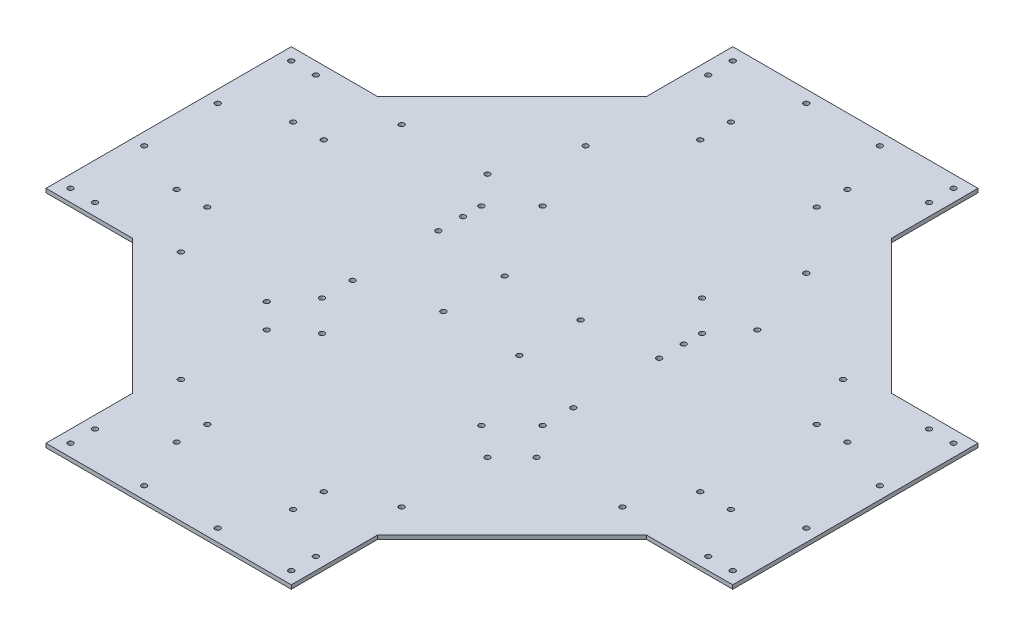
from build123d import *

# Parameters (mm, degrees)
SKETCH1_R           = 2.125
BOSS_EXTRUDE1_DEPTH = 3.175
SKETCH2_R           = 2.125
CUT_EXTRUDE1_DEPTH  = 396.992525971


with BuildPart() as part:
    # Sketch1 → Boss-Extrude1 (new body)
    with BuildSketch(Plane(origin=(0, 0, 0), x_dir=(1, 0, 0), z_dir=(0, 1, 0))):
        Polygon((-100, -280), (0, -280), (100, -280), (100, -209.601551084), (209.601551084, -100), (280, -100), (280, 0), (280, 100), (209.601551084, 100), (100, 209.601551084), (100, 280), (0, 280), (-100, 280), (-100, 209.601551084), (-209.601551084, 100), (-280, 100), (-280, 0), (-280, -100), (-209.601551084, -100), (-100, -209.601551084), align=None)
        with Locations((-90, -270)):
            Circle(SKETCH1_R, mode=Mode.SUBTRACT)
        with Locations((-90, -250)):
            Circle(SKETCH1_R, mode=Mode.SUBTRACT)
        with Locations((-30, -270)):
            Circle(SKETCH1_R, mode=Mode.SUBTRACT)
        with Locations((-47.5, -226)):
            Circle(SKETCH1_R, mode=Mode.SUBTRACT)
        with Locations((-90, -180)):
            Circle(SKETCH1_R, mode=Mode.SUBTRACT)
        with Locations((-47.5, -201)):
            Circle(SKETCH1_R, mode=Mode.SUBTRACT)
        with Locations((-270, -90)):
            Circle(SKETCH1_R, mode=Mode.SUBTRACT)
        with Locations((-250, -90)):
            Circle(SKETCH1_R, mode=Mode.SUBTRACT)
        with Locations((-180, -90)):
            Circle(SKETCH1_R, mode=Mode.SUBTRACT)
        with Locations((-226, -47.5)):
            Circle(SKETCH1_R, mode=Mode.SUBTRACT)
        with Locations((-270, -30)):
            Circle(SKETCH1_R, mode=Mode.SUBTRACT)
        with Locations((-201, -47.5)):
            Circle(SKETCH1_R, mode=Mode.SUBTRACT)
        with Locations((-90, -110)):
            Circle(SKETCH1_R, mode=Mode.SUBTRACT)
        with Locations((-110, -90)):
            Circle(SKETCH1_R, mode=Mode.SUBTRACT)
        with Locations((-90, -40)):
            Circle(SKETCH1_R, mode=Mode.SUBTRACT)
        with Locations((30, -270)):
            Circle(SKETCH1_R, mode=Mode.SUBTRACT)
        with Locations((47.5, -226)):
            Circle(SKETCH1_R, mode=Mode.SUBTRACT)
        with Locations((90, -270)):
            Circle(SKETCH1_R, mode=Mode.SUBTRACT)
        with Locations((90, -250)):
            Circle(SKETCH1_R, mode=Mode.SUBTRACT)
        with Locations((47.5, -201)):
            Circle(SKETCH1_R, mode=Mode.SUBTRACT)
        with Locations((90, -180)):
            Circle(SKETCH1_R, mode=Mode.SUBTRACT)
        with Locations((90, -110)):
            Circle(SKETCH1_R, mode=Mode.SUBTRACT)
        with Locations((110, -90)):
            Circle(SKETCH1_R, mode=Mode.SUBTRACT)
        with Locations((90, -40)):
            Circle(SKETCH1_R, mode=Mode.SUBTRACT)
        with Locations((180, -90)):
            Circle(SKETCH1_R, mode=Mode.SUBTRACT)
        with Locations((250, -90)):
            Circle(SKETCH1_R, mode=Mode.SUBTRACT)
        with Locations((270, -90)):
            Circle(SKETCH1_R, mode=Mode.SUBTRACT)
        with Locations((201, -47.5)):
            Circle(SKETCH1_R, mode=Mode.SUBTRACT)
        with Locations((226, -47.5)):
            Circle(SKETCH1_R, mode=Mode.SUBTRACT)
        with Locations((270, -30)):
            Circle(SKETCH1_R, mode=Mode.SUBTRACT)
        with Locations((-270, 30)):
            Circle(SKETCH1_R, mode=Mode.SUBTRACT)
        with Locations((-226, 47.5)):
            Circle(SKETCH1_R, mode=Mode.SUBTRACT)
        with Locations((-201, 47.5)):
            Circle(SKETCH1_R, mode=Mode.SUBTRACT)
        with Locations((-270, 90)):
            Circle(SKETCH1_R, mode=Mode.SUBTRACT)
        with Locations((-250, 90)):
            Circle(SKETCH1_R, mode=Mode.SUBTRACT)
        with Locations((-180, 90)):
            Circle(SKETCH1_R, mode=Mode.SUBTRACT)
        with Locations((-90, 30)):
            Circle(SKETCH1_R, mode=Mode.SUBTRACT)
        with Locations((-90, 50)):
            Circle(SKETCH1_R, mode=Mode.SUBTRACT)
        with Locations((-110, 90)):
            Circle(SKETCH1_R, mode=Mode.SUBTRACT)
        with Locations((-90, 150)):
            Circle(SKETCH1_R, mode=Mode.SUBTRACT)
        with Locations((-47.5, 201)):
            Circle(SKETCH1_R, mode=Mode.SUBTRACT)
        with Locations((-90, 250)):
            Circle(SKETCH1_R, mode=Mode.SUBTRACT)
        with Locations((-90, 270)):
            Circle(SKETCH1_R, mode=Mode.SUBTRACT)
        with Locations((-47.5, 226)):
            Circle(SKETCH1_R, mode=Mode.SUBTRACT)
        with Locations((-30, 270)):
            Circle(SKETCH1_R, mode=Mode.SUBTRACT)
        with Locations((90, 30)):
            Circle(SKETCH1_R, mode=Mode.SUBTRACT)
        with Locations((90, 50)):
            Circle(SKETCH1_R, mode=Mode.SUBTRACT)
        with Locations((110, 90)):
            Circle(SKETCH1_R, mode=Mode.SUBTRACT)
        with Locations((201, 47.5)):
            Circle(SKETCH1_R, mode=Mode.SUBTRACT)
        with Locations((270, 30)):
            Circle(SKETCH1_R, mode=Mode.SUBTRACT)
        with Locations((226, 47.5)):
            Circle(SKETCH1_R, mode=Mode.SUBTRACT)
        with Locations((180, 90)):
            Circle(SKETCH1_R, mode=Mode.SUBTRACT)
        with Locations((250, 90)):
            Circle(SKETCH1_R, mode=Mode.SUBTRACT)
        with Locations((270, 90)):
            Circle(SKETCH1_R, mode=Mode.SUBTRACT)
        with Locations((47.5, 201)):
            Circle(SKETCH1_R, mode=Mode.SUBTRACT)
        with Locations((90, 150)):
            Circle(SKETCH1_R, mode=Mode.SUBTRACT)
        with Locations((47.5, 226)):
            Circle(SKETCH1_R, mode=Mode.SUBTRACT)
        with Locations((30, 270)):
            Circle(SKETCH1_R, mode=Mode.SUBTRACT)
        with Locations((90, 250)):
            Circle(SKETCH1_R, mode=Mode.SUBTRACT)
        with Locations((90, 270)):
            Circle(SKETCH1_R, mode=Mode.SUBTRACT)
    extrude(amount=BOSS_EXTRUDE1_DEPTH)

    # Sketch2 → Cut-Extrude1 (cut, through all)
    with BuildSketch(Plane(origin=(0, 3.175, 0), x_dir=(1, 0, 0), z_dir=(0, 1, 0))):
        with Locations((-31, 25)):
            Circle(SKETCH2_R)
        with Locations((-31, -25)):
            Circle(SKETCH2_R)
        with Locations((31, -25)):
            Circle(SKETCH2_R)
        with Locations((31, 25)):
            Circle(SKETCH2_R)
        with Locations((-90, 65)):
            Circle(SKETCH2_R)
        with Locations((-65, 90)):
            Circle(SKETCH2_R)
        with Locations((65, 90)):
            Circle(SKETCH2_R)
        with Locations((90, 65)):
            Circle(SKETCH2_R)
        with Locations((90, -65)):
            Circle(SKETCH2_R)
        with Locations((65, -90)):
            Circle(SKETCH2_R)
        with Locations((-65, -90)):
            Circle(SKETCH2_R)
        with Locations((-90, -65)):
            Circle(SKETCH2_R)
    extrude(amount=-CUT_EXTRUDE1_DEPTH, mode=Mode.SUBTRACT)


solid = part.part
